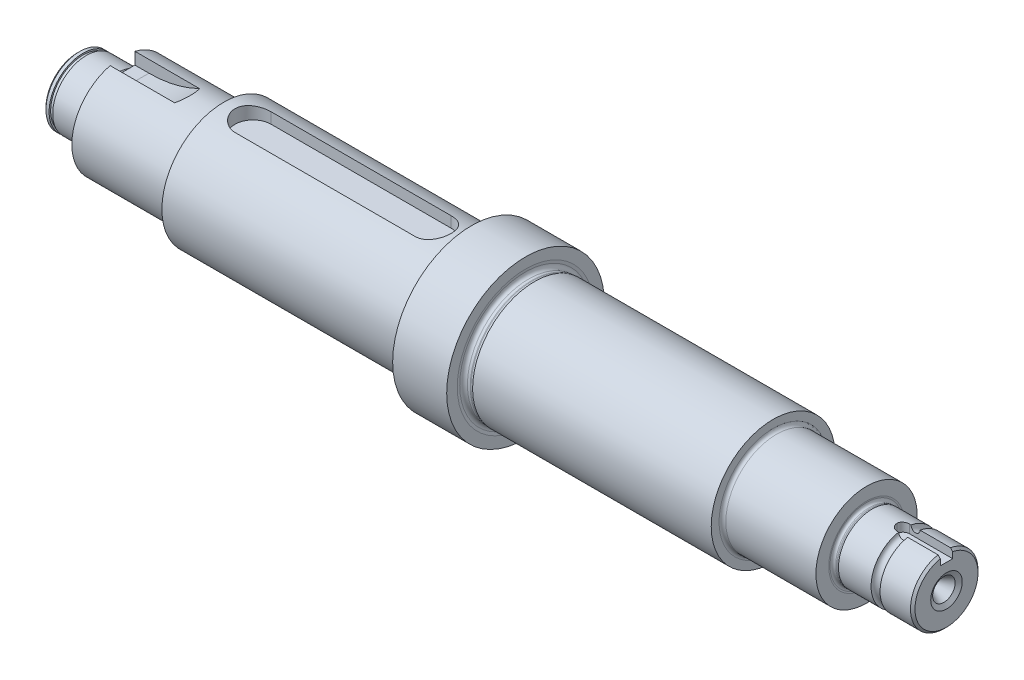
from build123d import *
from build123d.topology import SkipClean

# Parameters (mm, degrees)
SKETCH10_W                  = 1.6
SKETCH10_H                  = 0.7
UTOR_ZA_ALAT_ZA_LEZAJ_DEPTH = 5.5
CHAMFER1_SIZE               = 1
LIJEVI_START                = 27.5
LIJEVI_UTOR_ZA_PERO_DEPTH   = 6
DESNI_START                 = -27.5
DESNI_UTOR_ZA_PERO_DEPTH    = 6
CUT_EXTRUDE1_DEPTH          = 22
FILLET1_R                   = 2.75


# Read off the part's stored shape, not the designer's step: Cut-Revolve3
with BuildPart() as part:
    # Sketch2 → Glavno vratilo (revolve)
    with BuildSketch(Plane(origin=(0, 0, 0), x_dir=(1, 0, 0), z_dir=(0, 1, 0)), mode=Mode.PRIVATE) as glavno_vratilo_sk:
        Polygon((0, 0), (-12, 0), (-12, 15), (8, 15), (8, 22.5), (53, 22.5), (53, 27.5), (163, 27.5), (163, 35), (187, 35), (187, 27.5), (297, 27.5), (297, 22.5), (338.5, 22.5), (338.5, 15), (374, 15), (374, 0), align=None)
    revolve(glavno_vratilo_sk.sketch.rotate(Axis((-800.012303149, 0, 0), (1, 0, 0)), 180), axis=Axis((-800.012303149, 0, 0), (1, 0, 0)))

    # Sketch3 → Revolve2 (revolve)
    with BuildSketch(Plane.XY, mode=Mode.PRIVATE) as revolve2_sk:
        with BuildLine():
            Line((8, 15), (8, 16))
            ThreePointArc((8, 16), (7.857352815, 15.432545134), (7.463324958, 15))
            Line((7.463324958, 15), (8, 15))
        make_face()
    revolve(revolve2_sk.sketch.rotate(Axis((-800.012303149, 0, 0), (-1, 0, 0)), 90), axis=Axis((-800.012303149, 0, 0), (-1, 0, 0)))

    # Sketch3<6> → Cut-Revolve1 (revolve, cut)
    with BuildSketch(Plane.XY, mode=Mode.PRIVATE) as cut_revolve1_sk:
        with BuildLine():
            ThreePointArc((6.8, 14.8), (7.146410162, 14.851087471), (7.463324958, 15))
            Line((7.463324958, 15), (5.5, 15))
            Line((5.5, 15), (6.093810304, 14.840889008))
            ThreePointArc((6.093810304, 14.840889008), (6.247761728, 14.810266166), (6.404393159, 14.8))
            Line((6.404393159, 14.8), (6.8, 14.8))
        make_face()
    revolve(cut_revolve1_sk.sketch.rotate(Axis((-800.012303149, 0, 0), (-1, 0, 0)), 90), axis=Axis((-800.012303149, 0, 0), (-1, 0, 0)), mode=Mode.SUBTRACT)

    # Sketch4 → Revolve3 (revolve)
    with SkipClean():  # the faces are left unmerged after this step: merging them gives an invalid solid
        with BuildSketch(Plane.XY, mode=Mode.PRIVATE) as revolve3_sk:
            with BuildLine():
                Line((53, 24), (53, 22.5))
                Line((53, 22.5), (51.5, 22.5))
                ThreePointArc((51.5, 22.5), (52.560660172, 22.939339828), (53, 24))
            make_face()
        revolve(revolve3_sk.sketch.rotate(Axis((-800.012303149, 0, 0), (-1, 0, 0)), 90), axis=Axis((-800.012303149, 0, 0), (-1, 0, 0)))

    # Sketch5 → Revolve4 (revolve)
    with SkipClean():  # the faces are left unmerged after this step: merging them gives an invalid solid
        with BuildSketch(Plane.XY, mode=Mode.PRIVATE) as revolve4_sk:
            with BuildLine():
                Line((163, 27.5), (163, 28.8))
                ThreePointArc((163, 28.8), (162.823443123, 28.0693772), (162.332737905, 27.5))
                Line((162.332737905, 27.5), (163, 27.5))
            make_face()
        revolve(revolve4_sk.sketch.rotate(Axis((-800.012303149, 0, 0), (-1, 0, 0)), 90), axis=Axis((-800.012303149, 0, 0), (-1, 0, 0)))

    # Sketch5<3> → Cut-Revolve2 (revolve, cut)
    with SkipClean():  # the faces are left unmerged after this step: merging them gives an invalid solid
        with BuildSketch(Plane.XY, mode=Mode.PRIVATE) as cut_revolve2_sk:
            with BuildLine():
                ThreePointArc((161.4, 27.2), (161.889897949, 27.276845379), (162.332737905, 27.5))
                Line((162.332737905, 27.5), (159, 27.5))
                Line((159, 27.5), (159.916148766, 27.254518678))
                ThreePointArc((159.916148766, 27.254518678), (160.121417331, 27.213688222), (160.330259238, 27.2))
                Line((160.330259238, 27.2), (161.4, 27.2))
            make_face()
        revolve(cut_revolve2_sk.sketch.rotate(Axis((-800.012303149, 0, 0), (-1, 0, 0)), 90), axis=Axis((-800.012303149, 0, 0), (-1, 0, 0)), mode=Mode.SUBTRACT)

    # Sketch6 → Revolve5 (revolve)
    with SkipClean():  # the faces are left unmerged after this step: merging them gives an invalid solid
        with BuildSketch(Plane.XY, mode=Mode.PRIVATE) as revolve5_sk:
            with BuildLine():
                Line((187, 27.5), (187.472174959, 27.5))
                ThreePointArc((187.472174959, 27.5), (187.205940273, 27.740535642), (187, 28.034350051))
                Line((187, 28.034350051), (187, 27.5))
            make_face()
        revolve(revolve5_sk.sketch.rotate(Axis((-800.012303149, 0, 0), (-1, 0, 0)), 90), axis=Axis((-800.012303149, 0, 0), (-1, 0, 0)))

    # Cut-Revolve3 outline → Cut-Revolve3 (revolve, cut)
    with SkipClean():  # the faces are left unmerged after this step: merging them gives an invalid solid
        with BuildSketch(Plane.YX):
            with BuildLine():
                ThreePointArc((27.254518678, 190.083851234), (27.213688222, 189.878582669), (27.2, 189.669740762))
                Line((27.2, 189.669740762), (27.2, 188.404912864))
                ThreePointArc((27.2, 188.404912864), (27.276845379, 187.915014916), (27.5, 187.47217496))
                Line((27.5, 187.47217496), (27.5, 191))
                Line((27.5, 191), (27.254518678, 190.083851234))
            make_face()
            with BuildLine():
                Line((30.3, 187), (28.034350052, 187))
                ThreePointArc((28.034350052, 187), (28.514060463, 186.83067064), (29.022676962, 186.820483954))
                Line((29.022676962, 186.820483954), (30.3, 187))
            make_face()
        revolve(axis=Axis((0, 0, 0), (1, 0, 0)), mode=Mode.SUBTRACT)

    # Sketch7 → Revolve6 (revolve)
    with SkipClean():  # the faces are left unmerged after this step: merging them gives an invalid solid
        with BuildSketch(Plane.XY, mode=Mode.PRIVATE) as revolve6_sk:
            with BuildLine():
                Line((298.5, 22.5), (297, 22.5))
                Line((297, 22.5), (297, 24))
                ThreePointArc((297, 24), (297.439339828, 22.939339828), (298.5, 22.5))
            make_face()
        revolve(revolve6_sk.sketch.rotate(Axis((-800.012303149, 0, 0), (-1, 0, 0)), 270), axis=Axis((-800.012303149, 0, 0), (-1, 0, 0)))

    # Sketch8 → Revolve7 (revolve)
    with SkipClean():  # the faces are left unmerged after this step: merging them gives an invalid solid
        with BuildSketch(Plane.XY, mode=Mode.PRIVATE) as revolve7_sk:
            with BuildLine():
                Line((338.5, 15), (338.936035461, 15))
                ThreePointArc((338.936035461, 15), (338.680615152, 15.228049786), (338.5, 15.51895253))
                Line((338.5, 15.51895253), (338.5, 15))
            make_face()
        revolve(revolve7_sk.sketch.rotate(Axis((-800.012303149, 0, 0), (-1, 0, 0)), 270), axis=Axis((-800.012303149, 0, 0), (-1, 0, 0)))

    # Sketch8<4> → Cut-Revolve4 (revolve, cut)
    with SkipClean():  # the faces are left unmerged after this step: merging them gives an invalid solid
        with BuildSketch(Plane.XY, mode=Mode.PRIVATE) as cut_revolve4_sk:
            with BuildLine():
                Line((340.406189696, 14.840889008), (341, 15))
                Line((341, 15), (338.936035461, 15))
                ThreePointArc((338.936035461, 15), (339.252950258, 14.851087471), (339.599360419, 14.8))
                Line((339.599360419, 14.8), (340.095606841, 14.8))
                ThreePointArc((340.095606841, 14.8), (340.252238272, 14.810266166), (340.406189696, 14.840889008))
            make_face()
            with BuildLine():
                ThreePointArc((338.411038737, 16.167007721), (338.410509616, 15.836801447), (338.5, 15.51895253))
                Line((338.5, 15.51895253), (338.5, 16.8))
                Line((338.5, 16.8), (338.411038737, 16.167007721))
            make_face()
        revolve(cut_revolve4_sk.sketch.rotate(Axis((-800.012303149, 0, 0), (-1, 0, 0)), 90), axis=Axis((-800.012303149, 0, 0), (-1, 0, 0)), mode=Mode.SUBTRACT)

    # Sketch10 → Utor za uskocnik (revolve, cut)
    with SkipClean():  # the faces are left unmerged after this step: merging them gives an invalid solid
        with BuildSketch(Plane.XY, mode=Mode.PRIVATE) as utor_za_uskocnik_sk:
            with Locations((-8.8, 14.65)):
                Rectangle(SKETCH10_W, SKETCH10_H)
        revolve(utor_za_uskocnik_sk.sketch.rotate(Axis((-800.012303149, 0, 0), (-1, 0, 0)), 90), axis=Axis((-800.012303149, 0, 0), (-1, 0, 0)), mode=Mode.SUBTRACT)

    # Sketch11 → Utor za alat za lezaj (cut, symmetric)
    with SkipClean():  # the faces are left unmerged after this step: merging them gives an invalid solid
        with BuildSketch(Plane.XY):
            with BuildLine():
                Line((38, 22.5), (8, 22.5))
                Line((8, 22.5), (8, 16.5))
                Line((8, 16.5), (14.251315826, 16.5))
                ThreePointArc((14.251315826, 16.5), (26.49876454, 18.023201426), (38, 22.5))
            make_face()
        utor_za_alat_za_lezaj = extrude(amount=UTOR_ZA_ALAT_ZA_LEZAJ_DEPTH, both=True, mode=Mode.SUBTRACT)

    # Mirror1: Utor za alat za lezaj across plane
    with SkipClean():  # the faces are left unmerged after this step: merging them gives an invalid solid
        add(utor_za_alat_za_lezaj.mirror(Plane.ZX), mode=Mode.SUBTRACT)

    # Sketch12 → Utor za izlaz nareznice (revolve, cut)
    with SkipClean():  # the faces are left unmerged after this step: merging them gives an invalid solid
        with BuildSketch(Plane.XY, mode=Mode.PRIVATE) as utor_za_izlaz_nareznice_sk:
            with BuildLine():
                Line((355.5, -15), (359.5, -15))
                ThreePointArc((359.5, -15), (357.5, -13), (355.5, -15))
            make_face()
        revolve(utor_za_izlaz_nareznice_sk.sketch.rotate(Axis((-1000, 0, 0), (1, 0, 0)), 270), axis=Axis((-1000, 0, 0), (1, 0, 0)), mode=Mode.SUBTRACT)

    # Sketch14 → Cut-Revolve7 (revolve, cut)
    with SkipClean():  # the faces are left unmerged after this step: merging them gives an invalid solid
        with BuildSketch(Plane.XY, mode=Mode.PRIVATE) as cut_revolve7_sk:
            Polygon((362.598278762, 0), (363.8, 2), (367.649147039, 2), (372.845299462, 5), (374, 7), (374, 0), align=None)
        cut_revolve7 = revolve(cut_revolve7_sk.sketch.rotate(Axis((-1000, 0, 0), (1, 0, 0)), 90), axis=Axis((-1000, 0, 0), (1, 0, 0)), mode=Mode.SUBTRACT)

    # Mirror2: Cut-Revolve7 across plane
    with SkipClean():  # the faces are left unmerged after this step: merging them gives an invalid solid
        add(cut_revolve7.mirror(Plane(origin=(181, 0, 0), x_dir=(0, 0, 1), z_dir=(1, 0, 0))), mode=Mode.SUBTRACT)

    # Chamfer1
    chamfer1_edges = [part.edges().sort_by_distance(p)[0] for p in [
        (374, 0, -15),
        (-12, 0, -15),
    ]]
    chamfer(chamfer1_edges, length=CHAMFER1_SIZE)

    # Sketch15 → Lijevi utor za pero (cut)
    with SkipClean():  # the faces are left unmerged after this step: merging them gives an invalid solid
        with BuildSketch(Plane(origin=(0, 0, 0), x_dir=(1, 0, 0), z_dir=(0, 1, 0)).offset(LIJEVI_START)):
            with BuildLine():
                Line((66, 8), (146, 8))
                ThreePointArc((146, 8), (154, 0), (146, -8))
                Line((146, -8), (66, -8))
                ThreePointArc((66, -8), (58, 0), (66, 8))
            make_face()
        extrude(amount=-LIJEVI_UTOR_ZA_PERO_DEPTH, mode=Mode.SUBTRACT)

    # Sketch16 → Desni utor za pero (cut)
    with SkipClean():  # the faces are left unmerged after this step: merging them gives an invalid solid
        with BuildSketch(Plane(origin=(0, 0, 0), x_dir=(1, 0, 0), z_dir=(0, 1, 0)).offset(DESNI_START)):
            with BuildLine():
                Line((204, 8), (284, 8))
                ThreePointArc((284, 8), (292, 0), (284, -8))
                Line((284, -8), (204, -8))
                ThreePointArc((204, -8), (196, 0), (204, 8))
            make_face()
        extrude(amount=DESNI_UTOR_ZA_PERO_DEPTH, mode=Mode.SUBTRACT)

    # Sketch17 → Cut-Extrude1 (cut)
    with SkipClean():  # the faces are left unmerged after this step: merging them gives an invalid solid
        with BuildSketch(Plane(origin=(374, 0, 0), x_dir=(0, 0, -1), z_dir=(1, 0, 0))):
            with BuildLine():
                Line((-2.75, 14.745762103), (-2.75, 11))
                Line((-2.75, 11), (2.75, 11))
                Line((2.75, 11), (2.75, 14.745762103))
                ThreePointArc((2.75, 14.745762103), (0, 15), (-2.75, 14.745762103))
            make_face()
        extrude(amount=-CUT_EXTRUDE1_DEPTH, mode=Mode.SUBTRACT)

    # Fillet1
    fillet1_edges = [part.edges().sort_by_distance(p)[0] for p in [
        (352, 12.872881052, 2.75),
        (352, 12.872881052, -2.75),
    ]]
    fillet(fillet1_edges, radius=FILLET1_R - 0.0001)  # a hair under: the kernel refuses the full size


solid = part.part
